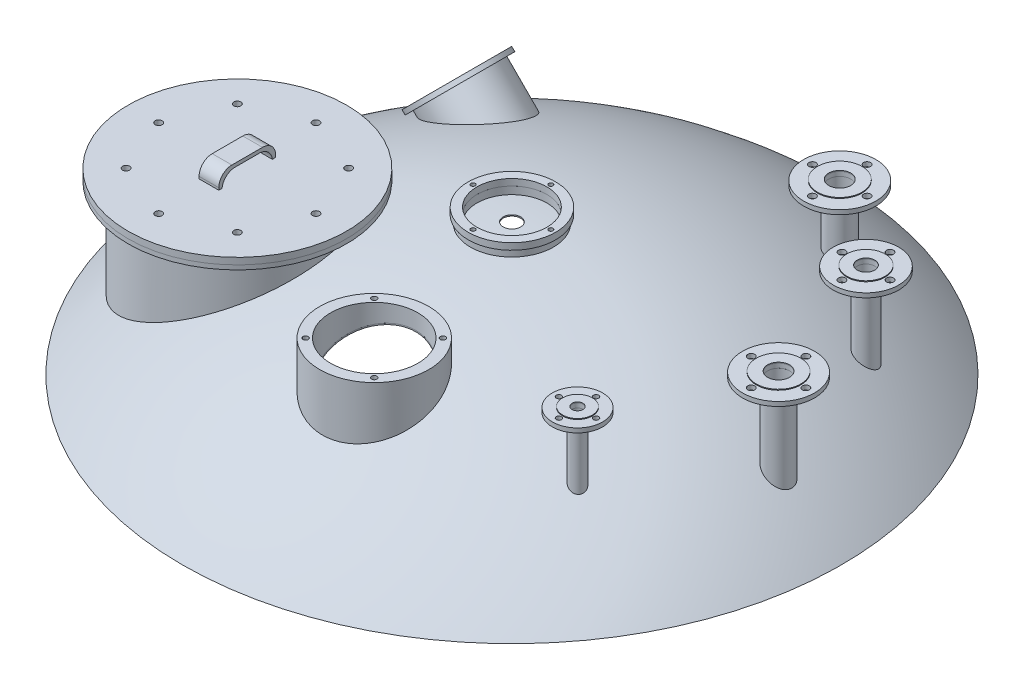
from build123d import *
from build123d.topology import SkipClean

# Parameters (mm, degrees)
IZIM5_R                           = 95
IZIM5_R_2                         = 80
Y_KSEKLIK_EKSTR_ZYON4_DEPTH       = 17
IZIM14_R                          = 100
IZIM14_R_2                        = 80
Y_KSEKLIK_EKSTR_ZYON10_DEPTH      = 15
IZIM3_R                           = 20
KES_EKSTR_ZYON5_DEPTH             = 519
Y_KSEKLIK_EKSTR_ZYON11_REACH      = 1350.842
Y_KSEKLIK_EKSTR_ZYON11_END_RADIUS = 1090.262468399
IZIM16_R                          = 87.5
IZIM16_R_2                        = 62.5
KES_EKSTR_ZYON6_START             = -93.459766
IZIM17_R                          = 62.5
KES_EKSTR_ZYON6_DEPTH             = 72.628369
Y_KSEKLIK_EKSTR_ZYON12_REACH      = 1109.715
Y_KSEKLIK_EKSTR_ZYON12_END_RADIUS = 1090.262468399
IZIM19_R                          = 212.5
IZIM19_R_2                        = 150
IZIM20_R                          = 150
KES_EKSTR_ZYON7_DEPTH             = 300
IZIM21_R                          = 6
KES_EKSTR_ZYON8_DEPTH             = 15
IZIM22_R                          = 102.5
IZIM22_R_2                        = 62.5
IZIM22_R_3                        = 6
Y_KSEKLIK_EKSTR_ZYON13_DEPTH      = 10
IZIM23_R                          = 62.500002816
Y_KSEKLIK_EKSTR_ZYON14_DEPTH      = 2.5
Y_KSEKLIK_EKSTR_ZYON15_START      = 10
IZIM24_R                          = 250
IZIM24_R_2                        = 150
Y_KSEKLIK_EKSTR_ZYON15_DEPTH      = 10
IZIM25_R                          = 8
KES_EKSTR_ZYON9_DEPTH             = 10
IZIM26_R                          = 250
IZIM26_R_2                        = 8
Y_KSEKLIK_EKSTR_ZYON16_DEPTH      = 15
IZIM27_W                          = 45
IZIM27_H                          = 130
Y_KSEKLIK_EKSTR_ZYON17_DEPTH      = 35
IZIM28_W                          = 115
IZIM28_H                          = 27
KES_EKSTR_ZYON10_DEPTH            = 52
RADYUS1_R                         = 30
Y_KSEKLIK_EKSTR_ZYON18_REACH      = 1109.715
Y_KSEKLIK_EKSTR_ZYON18_END_RADIUS = 1090.262468399
IZIM29_R                          = 24.15
IZIM29_R_2                        = 20
IZIM29_R_3                        = 16.85
IZIM29_R_4                        = 12.5
IZIM29_R_5                        = 30.15
IZIM29_R_6                        = 25
IZIM31_R                          = 82.5
IZIM31_R_2                        = 25.000000001
Y_KSEKLIK_EKSTR_ZYON19_DEPTH      = 10
IZIM31_R_3                        = 57.5
IZIM31_R_4                        = 12.5
Y_KSEKLIK_EKSTR_ZYON19_2_DEPTH    = 10
IZIM31_R_5                        = 75
IZIM31_R_6                        = 20
Y_KSEKLIK_EKSTR_ZYON19_3_DEPTH    = 10
IZIM32_R                          = 51
IZIM32_R_2                        = 25.000000001
Y_KSEKLIK_EKSTR_ZYON20_DEPTH      = 2
IZIM32_R_3                        = 34
IZIM32_R_4                        = 12.5
Y_KSEKLIK_EKSTR_ZYON20_2_DEPTH    = 2
IZIM32_R_5                        = 44
IZIM32_R_6                        = 20
Y_KSEKLIK_EKSTR_ZYON20_3_DEPTH    = 2
Y_KSEKLIK_EKSTR_ZYON21_REACH      = 1109.715
Y_KSEKLIK_EKSTR_ZYON21_END_RADIUS = 1090.262468399
IZIM35_R                          = 125
IZIM35_R_2                        = 100
Y_KSEKLIK_EKSTR_ZYON22_REACH      = 1109.715
Y_KSEKLIK_EKSTR_ZYON22_END_RADIUS = 1090.262468399
IZIM38_R                          = 30.15
IZIM38_R_2                        = 25
IZIM40_R                          = 82.5
IZIM40_R_2                        = 25
Y_KSEKLIK_EKSTR_ZYON23_DEPTH      = 10
IZIM41_R                          = 51
IZIM41_R_2                        = 25
Y_KSEKLIK_EKSTR_ZYON24_DEPTH      = 2
KES_EKSTR_ZYON11_START            = -198
KES_EKSTR_ZYON11_OUTLINE_R        = 19
KES_EKSTR_ZYON11_DEPTH            = 29
KES_EKSTR_ZYON12_START            = -117.309879
IZIM43_R                          = 100.000000038
KES_EKSTR_ZYON12_DEPTH            = 80.433327
IZIM15_R                          = 5
KES_EKSTR_ZYON13_DEPTH            = 10
IZIM44_R                          = 12.500002353
KES_EKSTR_ZYON15_DEPTH            = 300
IZIM45_R                          = 6
KES_EKSTR_ZYON19_DEPTH            = 15
IZIM46_R                          = 8
IZIM46_R_2                        = 6
KES_EKSTR_ZYON20_DEPTH            = 30


with BuildPart() as part:
    # Çizim1 → Döndür1 (revolve)
    with BuildSketch(Plane.XY):
        with BuildLine():
            Line((-750, 0), (-754, 0))
            ThreePointArc((-754, 0), (-406.257649858, 224.244519102), (0, 302.762468399))
            Line((0, 302.762468399), (0, 300))
            ThreePointArc((0, 300), (-403.887360535, 222.218401338), (-750, 0))
        make_face()
    revolve(axis=Axis((0, 300, 0), (0, -1, 0)))

    # Çizim3 → Kes-Ekstrüzyon5 (cut)
    with BuildSketch(Plane(origin=(0, 0, 0), x_dir=(1, 0, 0), z_dir=(0, 1, 0))):
        with Locations(Location((0, 0, 0), (0, 0, 180))):
            Circle(IZIM3_R)
    extrude(amount=KES_EKSTR_ZYON5_DEPTH, mode=Mode.SUBTRACT)

    # Yükseklik-Ekstrüzyon11: up to this sphere (the profile starts outside it)
    y_kseklik_ekstr_zyon11_end = Location((0, -787.5, 0)) * Sphere(Y_KSEKLIK_EKSTR_ZYON11_END_RADIUS, mode=Mode.PRIVATE)
    # Çizim16 → Yükseklik-Ekstrüzyon11 (add, up to the surface)
    with BuildSketch(Plane(origin=(-318.198051534, 318.198051534, 0), x_dir=(-0.7071067811865477, -0.7071067811865475, 0), z_dir=(0.7071067811865475, -0.7071067811865477, 0)), mode=Mode.PRIVATE) as y_kseklik_ekstr_zyon11_sk1:
        with Locations(Location((105.998925512, 274.305774922, 0), (0, 0, 29.201250711))):
            Circle(IZIM16_R)
        with Locations(Location((105.998925512, 274.305774922, 0), (0, 0, 31.552837385))):
            Circle(IZIM16_R_2, mode=Mode.SUBTRACT)
    y_kseklik_ekstr_zyon11_tool1 = extrude(y_kseklik_ekstr_zyon11_sk1.sketch, amount=Y_KSEKLIK_EKSTR_ZYON11_REACH, mode=Mode.PRIVATE) - y_kseklik_ekstr_zyon11_end
    add(y_kseklik_ekstr_zyon11_tool1.solids().sort_by_distance((-340.669566, 295.726537, -232.823826))[0])

    # Çizim17 → Kes-Ekstrüzyon6 (cut)
    with BuildSketch(Plane(origin=(-318.198051534, 318.198051534, 0), x_dir=(0, 0, 1), z_dir=(-0.7071067811865476, 0.7071067811865476, 0)).offset(KES_EKSTR_ZYON6_START)):
        with Locations(Location((-274.305774922, -105.998925512, 0), (0, 0, 236.608251796))):
            Circle(IZIM17_R)
    extrude(amount=KES_EKSTR_ZYON6_DEPTH, mode=Mode.SUBTRACT)

    # Yükseklik-Ekstrüzyon12: up to this sphere (the profile starts outside it)
    y_kseklik_ekstr_zyon12_end = Location((0, -787.5, 0)) * Sphere(Y_KSEKLIK_EKSTR_ZYON12_END_RADIUS, mode=Mode.PRIVATE)
    # Çizim19 → Yükseklik-Ekstrüzyon12 (add, up to the surface)
    with BuildSketch(Plane(origin=(0, 300, 0), x_dir=(-1, 0, 0), z_dir=(0, -1, 0)), mode=Mode.PRIVATE) as y_kseklik_ekstr_zyon12_sk1:
        with Locations(Location((398.156184436, -230.049812295, 0), (0, 0, 36.337185626))):
            Circle(IZIM19_R)
        with Locations(Location((398.156184436, -230.049812295, 0), (0, 0, 42.481887867))):
            Circle(IZIM19_R_2, mode=Mode.SUBTRACT)
    y_kseklik_ekstr_zyon12_tool1 = extrude(y_kseklik_ekstr_zyon12_sk1.sketch, amount=Y_KSEKLIK_EKSTR_ZYON12_REACH, mode=Mode.PRIVATE) - y_kseklik_ekstr_zyon12_end
    add(y_kseklik_ekstr_zyon12_tool1.solids().sort_by_distance((-231.819755, 300, 352.402352))[0])

    # Çizim20 → Kes-Ekstrüzyon7 (cut)
    with BuildSketch(Plane(origin=(0, 300, 0), x_dir=(1, 0, 0), z_dir=(0, 1, 0))):
        with Locations(Location((-398.156184436, -230.049812295, 0), (0, 0, 143.670714922))):
            Circle(IZIM20_R)
    extrude(amount=-KES_EKSTR_ZYON7_DEPTH, mode=Mode.SUBTRACT)

    # Çizim21 → Kes-Ekstrüzyon8 (cut)
    with BuildSketch(Plane(origin=(-318.198051534, 318.198051534, 0), x_dir=(0, 0, 1), z_dir=(-0.7071067811865476, 0.7071067811865476, 0))):
        with Locations(Location((-274.305774922, -32.998925512, 0), (0, 0, 270))):
            Circle(IZIM21_R)
        with Locations(Location((-211.085920446, -69.498925512, 0), (0, 0, 270))):
            Circle(IZIM21_R)
        with Locations(Location((-211.085920446, -142.498925512, 0), (0, 0, 270))):
            Circle(IZIM21_R)
        with Locations(Location((-274.305774922, -178.998925512, 0), (0, 0, 270))):
            Circle(IZIM21_R)
        with Locations(Location((-337.525629398, -142.498925512, 0), (0, 0, 270))):
            Circle(IZIM21_R)
        with Locations(Location((-337.525629398, -69.498925512, 0), (0, 0, 270))):
            Circle(IZIM21_R)
    extrude(amount=-KES_EKSTR_ZYON8_DEPTH, mode=Mode.SUBTRACT)

    # Çizim23 → Yükseklik-Ekstrüzyon14 (add, symmetric)
    with BuildSketch(Plane(origin=(-318.198051534, 318.198051534, 0), x_dir=(0, 0, 1), z_dir=(-0.7071067811865476, 0.7071067811865476, 0))):
        with Locations(Location((-274.305774922, -105.998925512, 0), (0, 0, 270))):
            Circle(IZIM23_R)
    extrude(amount=Y_KSEKLIK_EKSTR_ZYON14_DEPTH, both=True)

    # Çizim24 → Yükseklik-Ekstrüzyon15 (add)
    with SkipClean():  # the faces are left unmerged after this step: merging them gives an invalid solid
        with BuildSketch(Plane(origin=(0, 300, 0), x_dir=(1, 0, 0), z_dir=(0, 1, 0)).offset(Y_KSEKLIK_EKSTR_ZYON15_START)):
            with Locations(Location((-398.156184436, -230.049812295, 0), (0, 0, 270))):
                Circle(IZIM24_R)
            with Locations(Location((-398.156184436, -230.049812295, 0), (0, 0, 270))):
                Circle(IZIM24_R_2, mode=Mode.SUBTRACT)
        extrude(amount=-Y_KSEKLIK_EKSTR_ZYON15_DEPTH)

    # Çizim25 → Kes-Ekstrüzyon9 (cut)
    with SkipClean():  # the faces are left unmerged after this step: merging them gives an invalid solid
        with BuildSketch(Plane(origin=(0, 310, 0), x_dir=(1, 0, 0), z_dir=(0, 1, 0))):
            with Locations(Location((-218.156184436, -230.049812295, 0), (0, 0, 270))):
                Circle(IZIM25_R)
            with Locations(Location((-270.876963822, -357.329032908, 0), (0, 0, 270))):
                Circle(IZIM25_R)
            with Locations(Location((-398.156184436, -410.049812295, 0), (0, 0, 270))):
                Circle(IZIM25_R)
            with Locations(Location((-525.435405049, -357.329032908, 0), (0, 0, 270))):
                Circle(IZIM25_R)
            with Locations(Location((-578.156184436, -230.049812295, 0), (0, 0, 270))):
                Circle(IZIM25_R)
            with Locations(Location((-525.435405049, -102.770591681, 0), (0, 0, 270))):
                Circle(IZIM25_R)
            with Locations(Location((-398.156184436, -50.049812295, 0), (0, 0, 270))):
                Circle(IZIM25_R)
            with Locations(Location((-270.876963822, -102.770591681, 0), (0, 0, 270))):
                Circle(IZIM25_R)
        extrude(amount=-KES_EKSTR_ZYON9_DEPTH, mode=Mode.SUBTRACT)

    # Kes-Ekstrüzyon11: read off the stored shape, not the designer's step
    # Kes-Ekstrüzyon11 outline → Kes-Ekstrüzyon11 (cut)
    with SkipClean():  # the faces are left unmerged after this step: merging them gives an invalid solid
        with BuildSketch(Plane(origin=(0, 312, 0), x_dir=(1, 0, 0), z_dir=(0, 1, 0)).offset(KES_EKSTR_ZYON11_START)):
            with Locations((500, 310)):
                Circle(KES_EKSTR_ZYON11_OUTLINE_R)
        extrude(amount=KES_EKSTR_ZYON11_DEPTH, mode=Mode.SUBTRACT)

    # Çizim43 → Kes-Ekstrüzyon12 (cut)
    with SkipClean():  # the faces are left unmerged after this step: merging them gives an invalid solid
        with BuildSketch(Plane(origin=(0, 300, 0), x_dir=(1, 0, 0), z_dir=(0, 1, 0)).offset(KES_EKSTR_ZYON12_START)):
            with Locations(Location((70, -385, 0), (0, 0, 134.325873834))):
                Circle(IZIM43_R)
        extrude(amount=KES_EKSTR_ZYON12_DEPTH, mode=Mode.SUBTRACT)

    # Çizim44 → Kes-Ekstrüzyon15 (cut)
    with SkipClean():  # the faces are left unmerged after this step: merging them gives an invalid solid
        with BuildSketch(Plane(origin=(0, 312, 0), x_dir=(1, 0, 0), z_dir=(0, 1, 0))):
            with Locations(Location((450, -300, 0), (0, 0, 270))):
                Circle(IZIM44_R)
        extrude(amount=-KES_EKSTR_ZYON15_DEPTH, mode=Mode.SUBTRACT)


with BuildPart() as body_2:
    # Çizim5 → Yükseklik-Ekstrüzyon4 (new body)
    with BuildSketch(Plane(origin=(0, 300, 0), x_dir=(-1, 0, 0), z_dir=(0, -1, 0))):
        with Locations(Location((0, 0, 0), (0, 0, 90))):
            Circle(IZIM5_R)
        with Locations(Location((0, 0, 0), (0, 0, 90))):
            Circle(IZIM5_R_2, mode=Mode.SUBTRACT)
    extrude(amount=-Y_KSEKLIK_EKSTR_ZYON4_DEPTH)


with BuildPart() as body_3:
    # Çizim14 → Yükseklik-Ekstrüzyon10 (new body)
    with BuildSketch(Plane(origin=(0, 317, 0), x_dir=(1, 0, 0), z_dir=(0, 1, 0))):
        with Locations(Location((0, 0, 0), (0, 0, 270))):
            Circle(IZIM14_R)
        with Locations(Location((0, 0, 0), (0, 0, 270))):
            Circle(IZIM14_R_2, mode=Mode.SUBTRACT)
    extrude(amount=Y_KSEKLIK_EKSTR_ZYON10_DEPTH)

    # Çizim15 → Kes-Ekstrüzyon13 (cut)
    with BuildSketch(Plane(origin=(0, 332, 0), x_dir=(1, 0, 0), z_dir=(0, 1, 0))):
        with Locations(Location((89, 0, 0), (0, 0, 270))):
            Circle(IZIM15_R)
        with Locations(Location((0, -89, 0), (0, 0, 270))):
            Circle(IZIM15_R)
        with Locations(Location((-89, 0, 0), (0, 0, 270))):
            Circle(IZIM15_R)
        with Locations(Location((0, 89, 0), (0, 0, 270))):
            Circle(IZIM15_R)
    extrude(amount=-KES_EKSTR_ZYON13_DEPTH, mode=Mode.SUBTRACT)


with BuildPart() as body_4:
    # Çizim22 → Yükseklik-Ekstrüzyon13 (new body)
    with BuildSketch(Plane(origin=(-318.198051534, 318.198051534, 0), x_dir=(0, 0, 1), z_dir=(-0.7071067811865476, 0.7071067811865476, 0))):
        with Locations(Location((-274.305774922, -105.998925512, 0), (0, 0, 270))):
            Circle(IZIM22_R)
        with Locations(Location((-274.305774922, -105.998925512, 0), (0, 0, 270))):
            Circle(IZIM22_R_2, mode=Mode.SUBTRACT)
        with Locations(Location((-274.305774922, -32.998925512, 0), (0, 0, 270))):
            Circle(IZIM22_R_3, mode=Mode.SUBTRACT)
        with Locations(Location((-211.085920446, -69.498925512, 0), (0, 0, 270))):
            Circle(IZIM22_R_3, mode=Mode.SUBTRACT)
        with Locations(Location((-211.085920446, -142.498925512, 0), (0, 0, 270))):
            Circle(IZIM22_R_3, mode=Mode.SUBTRACT)
        with Locations(Location((-274.305774922, -178.998925512, 0), (0, 0, 270))):
            Circle(IZIM22_R_3, mode=Mode.SUBTRACT)
        with Locations(Location((-337.525629398, -142.498925512, 0), (0, 0, 270))):
            Circle(IZIM22_R_3, mode=Mode.SUBTRACT)
        with Locations(Location((-337.525629398, -69.498925512, 0), (0, 0, 270))):
            Circle(IZIM22_R_3, mode=Mode.SUBTRACT)
    extrude(amount=Y_KSEKLIK_EKSTR_ZYON13_DEPTH)


with BuildPart() as body_5:
    # Çizim26 → Yükseklik-Ekstrüzyon16 (new body)
    with BuildSketch(Plane(origin=(0, 310, 0), x_dir=(1, 0, 0), z_dir=(0, 1, 0))):
        with Locations(Location((-398.156184436, -230.049812295, 0), (0, 0, 270))):
            Circle(IZIM26_R)
        with Locations(Location((-398.156184436, -410.049812295, 0), (0, 0, 270))):
            Circle(IZIM26_R_2, mode=Mode.SUBTRACT)
        with Locations(Location((-525.435405049, -357.329032908, 0), (0, 0, 270))):
            Circle(IZIM26_R_2, mode=Mode.SUBTRACT)
        with Locations(Location((-578.156184436, -230.049812295, 0), (0, 0, 270))):
            Circle(IZIM26_R_2, mode=Mode.SUBTRACT)
        with Locations(Location((-525.435405049, -102.770591681, 0), (0, 0, 270))):
            Circle(IZIM26_R_2, mode=Mode.SUBTRACT)
        with Locations(Location((-398.156184436, -50.049812295, 0), (0, 0, 270))):
            Circle(IZIM26_R_2, mode=Mode.SUBTRACT)
        with Locations(Location((-270.876963822, -102.770591681, 0), (0, 0, 270))):
            Circle(IZIM26_R_2, mode=Mode.SUBTRACT)
        with Locations(Location((-218.156184436, -230.049812295, 0), (0, 0, 270))):
            Circle(IZIM26_R_2, mode=Mode.SUBTRACT)
        with Locations(Location((-270.876963822, -357.329032908, 0), (0, 0, 270))):
            Circle(IZIM26_R_2, mode=Mode.SUBTRACT)
    extrude(amount=Y_KSEKLIK_EKSTR_ZYON16_DEPTH)

    # Çizim27 → Yükseklik-Ekstrüzyon17 (add)
    with BuildSketch(Plane(origin=(0, 325, 0), x_dir=(1, 0, 0), z_dir=(0, 1, 0))):
        with Locations((-398.156184436, -230.049812295)):
            Rectangle(IZIM27_W, IZIM27_H)
    extrude(amount=Y_KSEKLIK_EKSTR_ZYON17_DEPTH)

    # Çizim28 → Kes-Ekstrüzyon10 (cut)
    with BuildSketch(Plane.ZY.offset(420.656184436)):
        with Locations((230.049812295, 338.5)):
            Rectangle(IZIM28_W, IZIM28_H)
    extrude(amount=-KES_EKSTR_ZYON10_DEPTH, mode=Mode.SUBTRACT)

    # Radyus1
    # the kernel refuses this fillet: 30 mm, written as the material it adds along each edge
    with BuildSketch(Plane(origin=(-420.656184436, 352, 172.549812295), x_dir=(0, -1, 0), z_dir=(1, 0, 0))) as radyus1_piece_1:
        with BuildLine():
            CenterArc((30, -29.849623113), RADYUS1_R, 95.739170477, 84.260829523)
            Line((0, -29.849623113), (0, 0))
            Line((0, 0), (27, 0))
        make_face()
    extrude(amount=45)
    with BuildSketch(Plane(origin=(-420.656184436, 352, 287.549812295), x_dir=(0, 0, -1), z_dir=(1, 0, 0))) as radyus1_piece_2:
        with BuildLine():
            CenterArc((29.849623113, -30), RADYUS1_R, 90, 84.260829523)
            Line((0, -27), (0, 0))
            Line((0, 0), (29.849623113, 0))
        make_face()
    extrude(amount=45)
    # the kernel refuses this fillet: 30 mm, written as the material it takes off along each edge
    with BuildSketch(Plane(origin=(-300.656184436, 360, 165.049812295), x_dir=(0, -1, 0), z_dir=(-1, 0, 0)), Plane(origin=(-495.656184436, 360, 295.049812295), x_dir=(0, -1, 0), z_dir=(1, 0, 0))) as radyus1_2_piece_1:
        with BuildLine():
            CenterArc((RADYUS1_R, RADYUS1_R), RADYUS1_R, 180, 90)
            Line((0, RADYUS1_R), (0, 0))
            Line((0, 0), (RADYUS1_R, 0))
        make_face()
    extrude(amount=195, mode=Mode.SUBTRACT)


with BuildPart() as body_6:
    # Yükseklik-Ekstrüzyon18: up to this sphere (the profile starts outside it)
    y_kseklik_ekstr_zyon18_end = Location((0, -787.5, 0)) * Sphere(Y_KSEKLIK_EKSTR_ZYON18_END_RADIUS, mode=Mode.PRIVATE)
    # Çizim29 → Yükseklik-Ekstrüzyon18 (new, up to the surface)
    with BuildSketch(Plane(origin=(0, 300, 0), x_dir=(-1, 0, 0), z_dir=(0, -1, 0)), mode=Mode.PRIVATE) as y_kseklik_ekstr_zyon18_sk1:
        with Locations(Location((-500, 310, 0), (0, 0, 138.867909334))):
            Circle(IZIM29_R)
        with Locations(Location((-500, 310, 0), (0, 0, 140.957063181))):
            Circle(IZIM29_R_2, mode=Mode.SUBTRACT)
    y_kseklik_ekstr_zyon18_tool1 = extrude(y_kseklik_ekstr_zyon18_sk1.sketch, amount=Y_KSEKLIK_EKSTR_ZYON18_REACH, mode=Mode.PRIVATE) - y_kseklik_ekstr_zyon18_end
    add(y_kseklik_ekstr_zyon18_tool1.solids().sort_by_distance((482.32482, 300, -294.563516))[0])
    # Çizim29 → Yükseklik-Ekstrüzyon18 (new, up to the surface)
    with BuildSketch(Plane(origin=(0, 300, 0), x_dir=(-1, 0, 0), z_dir=(0, -1, 0)), mode=Mode.PRIVATE) as y_kseklik_ekstr_zyon18_sk2:
        with Locations(Location((-450, -300, 0), (0, 0, 223.495398334))):
            Circle(IZIM29_R_3)
        with Locations(Location((-450, -300, 0), (0, 0, 221.374520135))):
            Circle(IZIM29_R_4, mode=Mode.SUBTRACT)
    y_kseklik_ekstr_zyon18_tool2 = extrude(y_kseklik_ekstr_zyon18_sk2.sketch, amount=Y_KSEKLIK_EKSTR_ZYON18_REACH, mode=Mode.PRIVATE) - y_kseklik_ekstr_zyon18_end
    add(y_kseklik_ekstr_zyon18_tool2.solids().sort_by_distance((438.122243, 300, 288.730242))[0])
    # Çizim29 → Yükseklik-Ekstrüzyon18 (new, up to the surface)
    with BuildSketch(Plane(origin=(0, 300, 0), x_dir=(-1, 0, 0), z_dir=(0, -1, 0)), mode=Mode.PRIVATE) as y_kseklik_ekstr_zyon18_sk3:
        with Locations(Location((-610, 0, 0), (0, 0, 133.590113133))):
            Circle(IZIM29_R_5)
        with Locations(Location((-610, 0, 0), (0, 0, 121.379879794))):
            Circle(IZIM29_R_6, mode=Mode.SUBTRACT)
    y_kseklik_ekstr_zyon18_tool3 = extrude(y_kseklik_ekstr_zyon18_sk3.sketch, amount=Y_KSEKLIK_EKSTR_ZYON18_REACH, mode=Mode.PRIVATE) - y_kseklik_ekstr_zyon18_end
    add(y_kseklik_ekstr_zyon18_tool3.solids().sort_by_distance((589.799719, 300, 21.219715))[0])


with BuildPart() as body_7:
    # Çizim31 → Yükseklik-Ekstrüzyon19 (new body)
    with BuildSketch(Plane(origin=(0, 300, 0), x_dir=(1, 0, 0), z_dir=(0, 1, 0))):
        with Locations(Location((610, 0, 0), (0, 0, 270))):
            Circle(IZIM31_R)
        with Locations(Location((610, 0, 0), (0, 0, 270))):
            Circle(IZIM31_R_2, mode=Mode.SUBTRACT)
    extrude(amount=Y_KSEKLIK_EKSTR_ZYON19_DEPTH)


with BuildPart() as body_8:
    # Çizim31 → Y_kseklik-Ekstr_zyon19 2 (new body)
    with BuildSketch(Plane(origin=(0, 300, 0), x_dir=(1, 0, 0), z_dir=(0, 1, 0))):
        with Locations(Location((450, -300, 0), (0, 0, 270))):
            Circle(IZIM31_R_3)
        with Locations(Location((450, -300, 0), (0, 0, 270))):
            Circle(IZIM31_R_4, mode=Mode.SUBTRACT)
    extrude(amount=Y_KSEKLIK_EKSTR_ZYON19_2_DEPTH)


with BuildPart() as body_9:
    # Çizim31 → Y_kseklik-Ekstr_zyon19 3 (new body)
    with BuildSketch(Plane(origin=(0, 300, 0), x_dir=(1, 0, 0), z_dir=(0, 1, 0))):
        with Locations(Location((500, 310, 0), (0, 0, 270))):
            Circle(IZIM31_R_5)
        with Locations(Location((500, 310, 0), (0, 0, 270))):
            Circle(IZIM31_R_6, mode=Mode.SUBTRACT)
    extrude(amount=Y_KSEKLIK_EKSTR_ZYON19_3_DEPTH)


with BuildPart() as body_10:
    # Çizim32 → Yükseklik-Ekstrüzyon20 (new body)
    with BuildSketch(Plane(origin=(0, 310, 0), x_dir=(1, 0, 0), z_dir=(0, 1, 0))):
        with Locations(Location((610, 0, 0), (0, 0, 270))):
            Circle(IZIM32_R)
        with Locations(Location((610, 0, 0), (0, 0, 270))):
            Circle(IZIM32_R_2, mode=Mode.SUBTRACT)
    extrude(amount=Y_KSEKLIK_EKSTR_ZYON20_DEPTH)


with BuildPart() as body_11:
    # Çizim32 → Y_kseklik-Ekstr_zyon20 2 (new body)
    with BuildSketch(Plane(origin=(0, 310, 0), x_dir=(1, 0, 0), z_dir=(0, 1, 0))):
        with Locations(Location((450, -300, 0), (0, 0, 270))):
            Circle(IZIM32_R_3)
        with Locations(Location((450, -300, 0), (0, 0, 270))):
            Circle(IZIM32_R_4, mode=Mode.SUBTRACT)
    extrude(amount=Y_KSEKLIK_EKSTR_ZYON20_2_DEPTH)


with BuildPart() as body_12:
    # Çizim32 → Y_kseklik-Ekstr_zyon20 3 (new body)
    with BuildSketch(Plane(origin=(0, 310, 0), x_dir=(1, 0, 0), z_dir=(0, 1, 0))):
        with Locations(Location((500, 310, 0), (0, 0, 270))):
            Circle(IZIM32_R_5)
        with Locations(Location((500, 310, 0), (0, 0, 270))):
            Circle(IZIM32_R_6, mode=Mode.SUBTRACT)
    extrude(amount=Y_KSEKLIK_EKSTR_ZYON20_3_DEPTH)


with BuildPart() as body_13:
    # Yükseklik-Ekstrüzyon21: up to this sphere (the profile starts outside it)
    y_kseklik_ekstr_zyon21_end = Location((0, -787.5, 0)) * Sphere(Y_KSEKLIK_EKSTR_ZYON21_END_RADIUS, mode=Mode.PRIVATE)
    # Çizim35 → Yükseklik-Ekstrüzyon21 (new, up to the surface)
    with BuildSketch(Plane(origin=(0, 300, 0), x_dir=(-1, 0, 0), z_dir=(0, -1, 0)), mode=Mode.PRIVATE) as y_kseklik_ekstr_zyon21_sk1:
        with Locations(Location((-70, -385, 0), (0, 0, 45.09493794))):
            Circle(IZIM35_R)
        with Locations(Location((-70, -385, 0), (0, 0, 45.674126166))):
            Circle(IZIM35_R_2, mode=Mode.SUBTRACT)
    y_kseklik_ekstr_zyon21_tool1 = extrude(y_kseklik_ekstr_zyon21_sk1.sketch, amount=Y_KSEKLIK_EKSTR_ZYON21_REACH, mode=Mode.PRIVATE) - y_kseklik_ekstr_zyon21_end
    add(y_kseklik_ekstr_zyon21_tool1.solids().sort_by_distance((155.745915, 300, 471.030545))[0])

    # Çizim45 → Kes-Ekstrüzyon19 (cut)
    with BuildSketch(Plane(origin=(0, 300, 0), x_dir=(1, 0, 0), z_dir=(0, 1, 0))):
        with Locations(Location((-8.488852712, -463.488852712, 0), (0, 0, 270))):
            Circle(IZIM45_R)
        with Locations(Location((-8.488852712, -306.511147288, 0), (0, 0, 90))):
            Circle(IZIM45_R)
        with Locations(Location((148.488852712, -306.511147288, 0), (0, 0, 270))):
            Circle(IZIM45_R)
        with Locations(Location((148.488852712, -463.488852712, 0), (0, 0, 90))):
            Circle(IZIM45_R)
    extrude(amount=-KES_EKSTR_ZYON19_DEPTH, mode=Mode.SUBTRACT)


with BuildPart() as body_14:
    # Yükseklik-Ekstrüzyon22: up to this sphere (the profile starts outside it)
    y_kseklik_ekstr_zyon22_end = Location((0, -787.5, 0)) * Sphere(Y_KSEKLIK_EKSTR_ZYON22_END_RADIUS, mode=Mode.PRIVATE)
    # Çizim38 → Yükseklik-Ekstrüzyon22 (new, up to the surface)
    with BuildSketch(Plane(origin=(0, 300, 0), x_dir=(-1, 0, 0), z_dir=(0, -1, 0)), mode=Mode.PRIVATE) as y_kseklik_ekstr_zyon22_sk1:
        with Locations(Location((-300, 450, 0), (0, 0, 56.50339345))):
            Circle(IZIM38_R)
        with Locations(Location((-300, 450, 0), (0, 0, 79.621670147))):
            Circle(IZIM38_R_2, mode=Mode.SUBTRACT)
    y_kseklik_ekstr_zyon22_tool1 = extrude(y_kseklik_ekstr_zyon22_sk1.sketch, amount=Y_KSEKLIK_EKSTR_ZYON22_REACH, mode=Mode.PRIVATE) - y_kseklik_ekstr_zyon22_end
    add(y_kseklik_ekstr_zyon22_tool1.solids().sort_by_distance((316.168777, 300, -425.568498))[0])


with BuildPart() as body_15:
    # Çizim40 → Yükseklik-Ekstrüzyon23 (new body)
    with BuildSketch(Plane(origin=(0, 300, 0), x_dir=(1, 0, 0), z_dir=(0, 1, 0))):
        with Locations(Location((300, 450, 0), (0, 0, 270))):
            Circle(IZIM40_R)
        with Locations(Location((300, 450, 0), (0, 0, 270))):
            Circle(IZIM40_R_2, mode=Mode.SUBTRACT)
    extrude(amount=Y_KSEKLIK_EKSTR_ZYON23_DEPTH)


with BuildPart() as body_16:
    # Çizim41 → Yükseklik-Ekstrüzyon24 (new body)
    with BuildSketch(Plane(origin=(0, 310, 0), x_dir=(1, 0, 0), z_dir=(0, 1, 0))):
        with Locations(Location((300, 450, 0), (0, 0, 270))):
            Circle(IZIM41_R)
        with Locations(Location((300, 450, 0), (0, 0, 270))):
            Circle(IZIM41_R_2, mode=Mode.SUBTRACT)
    extrude(amount=Y_KSEKLIK_EKSTR_ZYON24_DEPTH)


with BuildPart() as kes_ekstr_zyon20_tool:
    # Çizim46 → Kes-Ekstrüzyon20 (new body)
    with BuildSketch(Plane(origin=(0, 310, 0), x_dir=(1, 0, 0), z_dir=(0, 1, 0))):
        with Locations(Location((610, -62.5, 0), (0, 0, 270))):
            Circle(IZIM46_R)
        with Locations(Location((610, 62.5, 0), (0, 0, 270))):
            Circle(IZIM46_R)
        with Locations(Location((547.5, 0, 0), (0, 0, 270))):
            Circle(IZIM46_R)
        with Locations(Location((672.5, 0, 0), (0, 0, 270))):
            Circle(IZIM46_R)
        with Locations(Location((450, -342.5, 0), (0, 0, 270))):
            Circle(IZIM46_R_2)
        with Locations(Location((450, -257.5, 0), (0, 0, 270))):
            Circle(IZIM46_R_2)
        with Locations(Location((407.5, -300, 0), (0, 0, 270))):
            Circle(IZIM46_R_2)
        with Locations(Location((492.5, -300, 0), (0, 0, 270))):
            Circle(IZIM46_R_2)
        with Locations(Location((500, 255, 0), (0, 0, 270))):
            Circle(IZIM46_R)
        with Locations(Location((500, 365, 0), (0, 0, 270))):
            Circle(IZIM46_R)
        with Locations(Location((445, 310, 0), (0, 0, 270))):
            Circle(IZIM46_R)
        with Locations(Location((555, 310, 0), (0, 0, 270))):
            Circle(IZIM46_R)
        with Locations(Location((300, 387.5, 0), (0, 0, 270))):
            Circle(IZIM46_R)
        with Locations(Location((300, 512.5, 0), (0, 0, 270))):
            Circle(IZIM46_R)
        with Locations(Location((237.5, 450, 0), (0, 0, 270))):
            Circle(IZIM46_R)
        with Locations(Location((362.5, 450, 0), (0, 0, 270))):
            Circle(IZIM46_R)
    extrude(amount=-KES_EKSTR_ZYON20_DEPTH)


with BuildPart() as body_7_1:
    add(body_7.part)

    # Kes-Ekstrüzyon20: cut by kes_ekstr_zyon20_tool
    add(kes_ekstr_zyon20_tool.part, mode=Mode.SUBTRACT)


with BuildPart() as body_8_1:
    add(body_8.part)

    # Kes-Ekstrüzyon20: cut by kes_ekstr_zyon20_tool
    add(kes_ekstr_zyon20_tool.part, mode=Mode.SUBTRACT)


with BuildPart() as body_9_1:
    add(body_9.part)

    # Kes-Ekstrüzyon20: cut by kes_ekstr_zyon20_tool
    add(kes_ekstr_zyon20_tool.part, mode=Mode.SUBTRACT)


with BuildPart() as body_15_1:
    add(body_15.part)

    # Kes-Ekstrüzyon20: cut by kes_ekstr_zyon20_tool
    add(kes_ekstr_zyon20_tool.part, mode=Mode.SUBTRACT)


solid = Compound([part.part, body_2.part, body_3.part, body_4.part, body_5.part, body_6.part, body_10.part, body_11.part, body_12.part, body_13.part, body_14.part, body_16.part, body_7_1.part, body_8_1.part, body_9_1.part, body_15_1.part])
